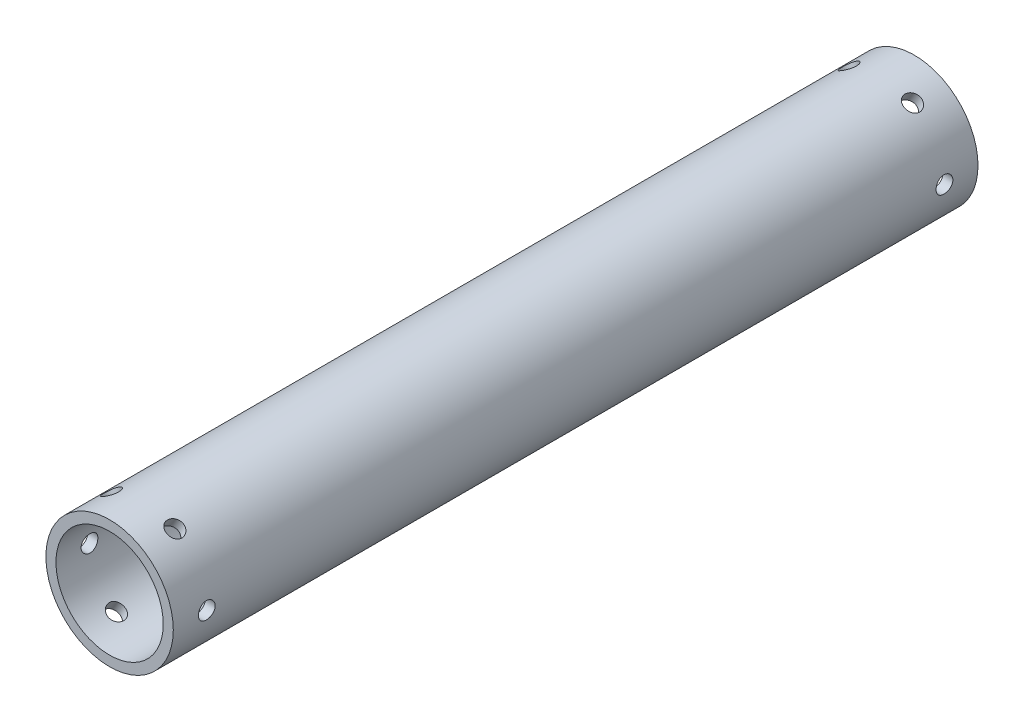
from build123d import *

# Parameters (mm, degrees)
SKETCH2_R         = 24.13
SKETCH2_R_2       = 20.32
BASE_DEPTH        = 304.8
BOLTHOLES_REACH   = 311.539
SKETCH3_R         = 3.175
CIRPATTERN1_COUNT = 6


with BuildPart() as part:
    # Sketch2 → base (new body)
    with BuildSketch(Plane(origin=(0, 0, 0), x_dir=(0, 1, 0), z_dir=(0, 0, 1))):
        Circle(SKETCH2_R)
        Circle(SKETCH2_R_2, mode=Mode.SUBTRACT)
    extrude(amount=BASE_DEPTH)

    # Sketch3 → boltholes (cut, up to next)
    with BuildSketch(Plane(origin=(24.13, 0, 0), x_dir=(0, 0, -1), z_dir=(1, 0, 0)), mode=Mode.PRIVATE) as boltholes_sk1:
        with Locations((-12.7, 0)):
            Circle(SKETCH3_R)
    boltholes_tool1 = extrude(boltholes_sk1.sketch, amount=-BOLTHOLES_REACH, mode=Mode.PRIVATE) & part.part
    # Sketch3 → boltholes (cut, up to next)
    with BuildSketch(Plane(origin=(24.13, 0, 0), x_dir=(0, 0, -1), z_dir=(1, 0, 0)), mode=Mode.PRIVATE) as boltholes_sk2:
        with Locations((-292.1, 0)):
            Circle(SKETCH3_R)
    boltholes_tool2 = extrude(boltholes_sk2.sketch, amount=-BOLTHOLES_REACH, mode=Mode.PRIVATE) & part.part
    boltholes_1 = boltholes_tool1.solids().sort_by_distance((24.13, 0, 12.7))[0]
    add(boltholes_1, mode=Mode.SUBTRACT)
    boltholes_2 = boltholes_tool2.solids().sort_by_distance((24.13, 0, 292.1))[0]
    add(boltholes_2, mode=Mode.SUBTRACT)
    boltholes = boltholes_1 + boltholes_2  # boltholes as one shape, for the pattern or mirror that repeats it

    # CirPattern1: boltholes ×6 about axis
    cirpattern1_axis = Axis((0, 0, 304.8), (0, 0, -1))
    for i in range(1, CIRPATTERN1_COUNT):
        add(boltholes.rotate(cirpattern1_axis, i * 360 / CIRPATTERN1_COUNT), mode=Mode.SUBTRACT)


solid = part.part
